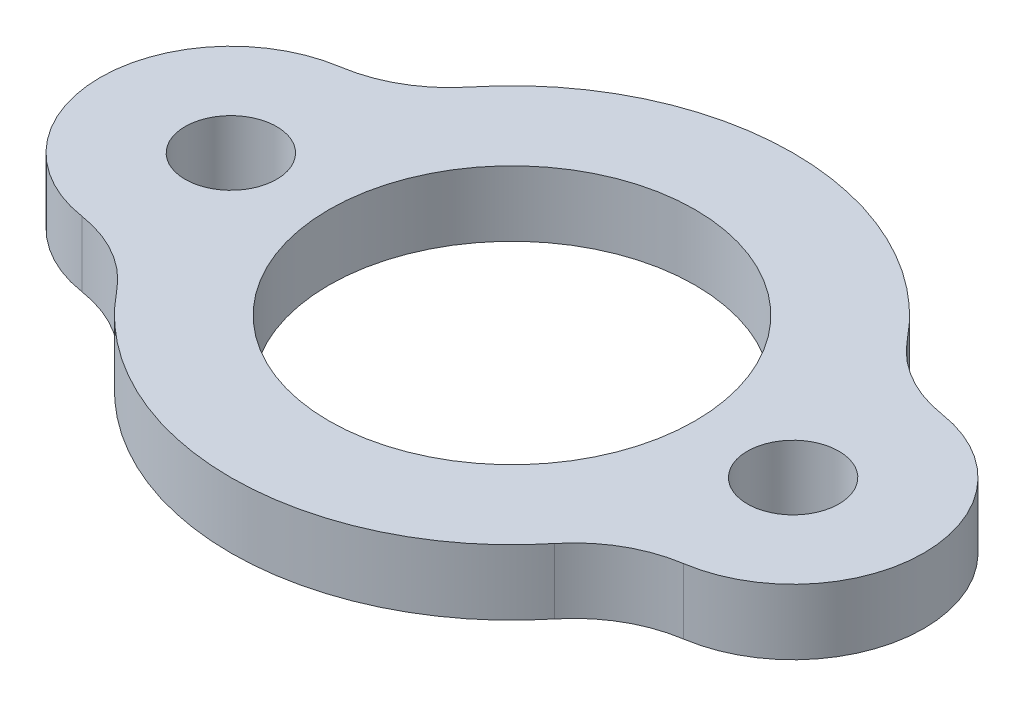
from build123d import *

# Parameters (mm, degrees)
BOSS_EXTRUDE2_OUTLINE_R   = 3.5
BOSS_EXTRUDE2_OUTLINE_R_2 = 14
BOSS_EXTRUDE2_DEPTH       = 5
FILLET2_R                 = 10


# Read off the part's stored shape, not the designer's step: Boss-Extrude2
with BuildPart() as part:
    # Boss-Extrude2 outline → Boss-Extrude2 (new body)
    with BuildSketch(Plane(origin=(0, 0, 0), x_dir=(1, 0, 0), z_dir=(0, 1, 0))):
        with BuildLine():
            ThreePointArc((19.174418605, 9.725824961), (0, 21.5), (-19.174418605, 9.725824961))
            ThreePointArc((-19.174418605, 9.725824961), (-31.5, 0), (-19.174418605, -9.725824961))
            ThreePointArc((-19.174418605, -9.725824961), (0, -21.5), (19.174418605, -9.725824961))
            ThreePointArc((19.174418605, -9.725824961), (31.5, 0), (19.174418605, 9.725824961))
        make_face()
        with Locations((-21.5, 0)):
            Circle(BOSS_EXTRUDE2_OUTLINE_R, mode=Mode.SUBTRACT)
        Circle(BOSS_EXTRUDE2_OUTLINE_R_2, mode=Mode.SUBTRACT)
        with Locations((21.5, 0)):
            Circle(BOSS_EXTRUDE2_OUTLINE_R, mode=Mode.SUBTRACT)
    extrude(amount=BOSS_EXTRUDE2_DEPTH)

    # Fillet2
    fillet2_edges = [part.edges().sort_by_distance(p)[0] for p in [
        (19.174418605, 2.5, -9.725824961),
        (19.174418605, 2.5, 9.725824961),
        (-19.174418605, 2.5, 9.725824961),
        (-19.174418605, 2.5, -9.725824961),
    ]]
    fillet(fillet2_edges, radius=FILLET2_R)


solid = part.part
